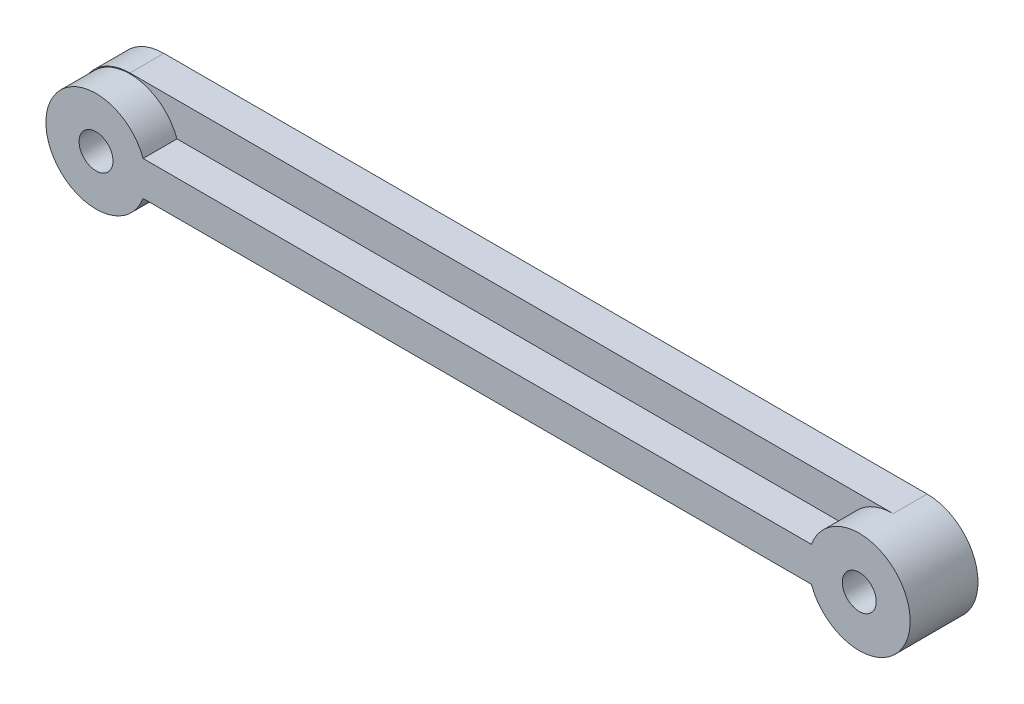
from build123d import *

# Parameters (mm, degrees)
SKETCH_1_R      = 0.5
EXTRUDE_1_DEPTH = 1
SKETCH_2_R      = 0.5
EXTRUDE_3_DEPTH = 1


with BuildPart() as part:
    # 草图1 → 凸台-拉伸1 (new body)
    with BuildSketch(Plane.XY):
        with BuildLine():
            Line((0, 1.5), (22.5, 1.5))
            ThreePointArc((22.5, 1.5), (24, 0), (22.5, -1.5))
            Line((22.5, -1.5), (0, -1.5))
            ThreePointArc((0, -1.5), (-1.5, 0), (0, 1.5))
        make_face()
        Circle(SKETCH_1_R, mode=Mode.SUBTRACT)
        with Locations((22.5, 0)):
            Circle(SKETCH_1_R, mode=Mode.SUBTRACT)
    extrude(amount=EXTRUDE_1_DEPTH)

    # 草图2 → 凸台-拉伸3 (add)
    with BuildSketch(Plane.XY.offset(1)):
        with BuildLine():
            Line((1.386826159, 0.509899392), (21.089325477, 0.509899392))
            ThreePointArc((21.089325477, 0.509899392), (24, 0), (21.089325477, -0.509899392))
            Line((21.089325477, -0.509899392), (1.386826159, -0.509899392))
            ThreePointArc((1.386826159, -0.509899392), (-1.477594053, 0), (1.386826159, 0.509899392))
        make_face()
        Circle(SKETCH_2_R, mode=Mode.SUBTRACT)
        with Locations((22.5, 0)):
            Circle(SKETCH_2_R, mode=Mode.SUBTRACT)
    extrude(amount=EXTRUDE_3_DEPTH)


solid = part.part
